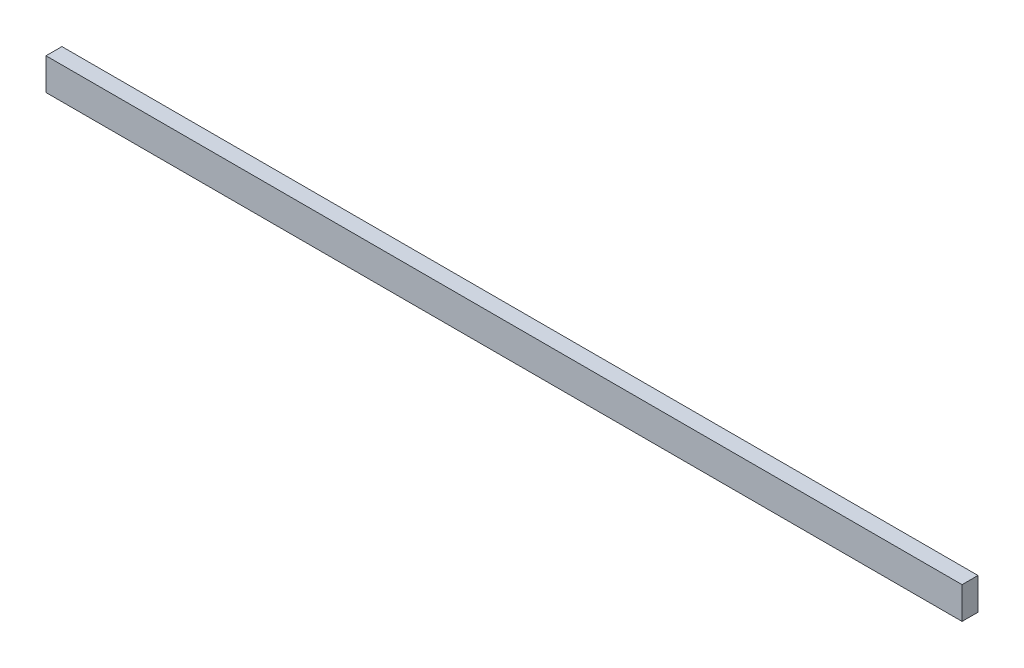
from build123d import *

# Parameters (mm, degrees)
SKETCH1_W           = 40
SKETCH1_H           = 80
BOSS_EXTRUDE1_DEPTH = 2300


with BuildPart() as part:
    # Sketch1 → Boss-Extrude1 (new body)
    with BuildSketch(Plane(origin=(0, 0, 0), x_dir=(0, 0, -1), z_dir=(1, 0, 0))):
        with Locations((20, -40)):
            Rectangle(SKETCH1_W, SKETCH1_H)
    extrude(amount=BOSS_EXTRUDE1_DEPTH)


solid = part.part
